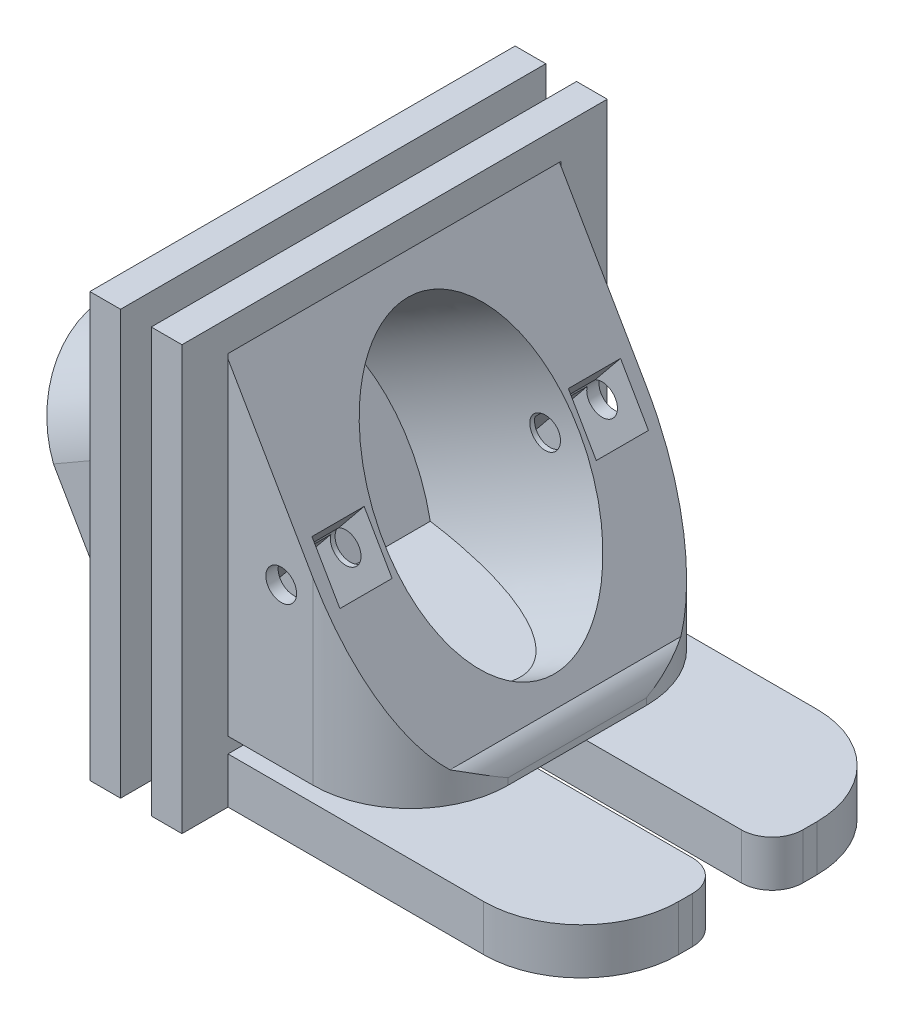
from build123d import *

# Parameters (mm, degrees)
SKETCH2_W           = 21.7
SKETCH2_H           = 25.05
SKETCH2_RX          = 9.525
SKETCH2_RY          = 6.35
BOSS_EXTRUDE1_DEPTH = 12.7
SKETCH3_W           = 21.660653916
SKETCH3_H           = 25.05
BOSS_EXTRUDE2_DEPTH = 3
SKETCH5_W           = 18.892037138
SKETCH5_H           = 21.7
BOSS_EXTRUDE3_DEPTH = 2
SKETCH6_W           = 30
SKETCH6_H           = 21.7
BOSS_EXTRUDE4_DEPTH = 4
SKETCH7_W           = 21.7
SKETCH7_H           = 1
SKETCH7_W_2         = 3.175
SKETCH7_H_2         = 3
CUT_EXTRUDE2_DEPTH  = 23
SKETCH7_3_W         = 21.7
SKETCH7_3_H         = 7.272473706
CUT_EXTRUDE3_DEPTH  = 44.803879418
SKETCH11_R          = 1
CUT_EXTRUDE8_DEPTH  = 33.487034031
CUT_EXTRUDE4_REACH  = 47.088
SKETCH9_R           = 1
SKETCH15_W          = 3.4
SKETCH15_H          = 3.4
CUT_EXTRUDE9_DEPTH  = 28.443249332
BOSS_EXTRUDE5_DEPTH = 2
BOSS_EXTRUDE6_DEPTH = 2
FILLET5_R           = 6.35
FILLET6_R           = 2
FILLET7_R           = 2
SKETCH19_W          = 2
SKETCH19_H          = 4
CUT_EXTRUDE10_DEPTH = 48.148292291


with BuildPart() as part:
    # Sketch2 → Boss-Extrude1 (new body)
    with BuildSketch(Plane(origin=(16.497783942, 9.525, 0), x_dir=(0, 0, -1), z_dir=(0.8660254037844379, 0.5000000000000013, 0))):
        Rectangle(SKETCH2_W, SKETCH2_H)
        with Locations(Location((0, 0), (0, 0, 90))):
            Ellipse(SKETCH2_RX, SKETCH2_RY, mode=Mode.SUBTRACT)
    extrude(amount=-BOSS_EXTRUDE1_DEPTH)

    # Sketch3 → Boss-Extrude2 (add)
    with BuildSketch(Plane(origin=(5.499261314, 3.175, 0), x_dir=(0, 0, 1), z_dir=(-0.8660254037844379, -0.5000000000000014, 0))):
        with Locations((-0.019673042, 0)):
            Rectangle(SKETCH3_W, SKETCH3_H)
    extrude(amount=BOSS_EXTRUDE2_DEPTH)

    # Sketch5 → Boss-Extrude3 (add)
    with BuildSketch(Plane(origin=(0, 0, 0), x_dir=(-1, 0, 0), z_dir=(0, 1, 0))):
        with Locations((-13.314265373, 0)):
            Rectangle(SKETCH5_W, SKETCH5_H)
    extrude(amount=-BOSS_EXTRUDE3_DEPTH)

    # Sketch6 → Boss-Extrude4 (add)
    with BuildSketch(Plane.XZ.offset(2)):
        with Locations((18.868246804, 0)):
            Rectangle(SKETCH6_W, SKETCH6_H)
    extrude(amount=BOSS_EXTRUDE4_DEPTH)

    # Sketch7 → Cut-Extrude2 (cut)
    with BuildSketch(Plane(origin=(33.868246804, 0, 0), x_dir=(0, 0, -1), z_dir=(1, 0, 0))):
        with Locations((0, -2.5)):
            Rectangle(SKETCH7_W, SKETCH7_H)
        with Locations((0, -4.5)):
            Rectangle(SKETCH7_W_2, SKETCH7_H_2)
    extrude(amount=-CUT_EXTRUDE2_DEPTH, mode=Mode.SUBTRACT)

    # Sketch7<3> → Cut-Extrude3 (cut, through all)
    with BuildSketch(Plane(origin=(33.868246804, 0, 0), x_dir=(0, 0, -1), z_dir=(1, 0, 0))):
        with Locations((0, -9.636236853)):
            Rectangle(SKETCH7_3_W, SKETCH7_3_H)
    extrude(amount=-CUT_EXTRUDE3_DEPTH, mode=Mode.SUBTRACT)

    # Sketch11 → Cut-Extrude8 (cut, through all)
    with BuildSketch(Plane(origin=(19.672783942, 0.194872981, 0), x_dir=(0, 0, -1), z_dir=(-1, 0, 0))):
        with Locations(Location((0, -3.830865705, 0), (0, 0, 90))):
            Circle(SKETCH11_R)
    extrude(amount=CUT_EXTRUDE8_DEPTH, mode=Mode.SUBTRACT)

    # Sketch9 → Cut-Extrude4 (cut, up to next)
    with BuildSketch(Plane(origin=(0, 0, -10.85), x_dir=(-1, 0, 0), z_dir=(0, 0, -1)), mode=Mode.PRIVATE) as cut_extrude4_sk1:
        with Locations((-14.332720433, 8.275)):
            Circle(SKETCH9_R)
    cut_extrude4_tool1 = extrude(cut_extrude4_sk1.sketch, amount=-CUT_EXTRUDE4_REACH, mode=Mode.PRIVATE) & part.part
    cut_extrude4 = cut_extrude4_tool1.solids().sort_by_distance((14.33272, 8.275, -10.85))[0]
    add(cut_extrude4, mode=Mode.SUBTRACT)

    # Sketch15 → Cut-Extrude9 (cut, symmetric)
    with BuildSketch(Plane(origin=(16.497783942, 9.525, 0), x_dir=(0.7757354378747654, -0.6310582623064579, 0), z_dir=(0.6310582623064579, 0.7757354378747654, 0))):
        with Locations((-0.1, -8.35)):
            Rectangle(SKETCH15_W, SKETCH15_H)
    cut_extrude9 = extrude(amount=CUT_EXTRUDE9_DEPTH, both=True, mode=Mode.SUBTRACT)

    # Sketch16 → Boss-Extrude5 (add)
    with BuildSketch(Plane(origin=(8.868246804, 0, 0), x_dir=(0, 0, -1), z_dir=(1, 0, 0))):
        Polygon((-10.85, -6), (-10.85, 19.582708922), (0, 19.582708922), (0, 21.582708922), (-13.85, 21.582708922), (-13.85, -6), align=None)
    boss_extrude5 = extrude(amount=BOSS_EXTRUDE5_DEPTH)

    # Sketch18 → Boss-Extrude6 (add)
    with BuildSketch(Plane.ZY.offset(-6.868246804)):
        Polygon((10.85, -6), (13.85, -6), (13.85, 21.582708922), (0, 21.582708922), (0, 14.582708922), (10.85, 14.582708922), align=None)
    boss_extrude6 = extrude(amount=BOSS_EXTRUDE6_DEPTH)

    # Mirror1: Cut-Extrude4, Cut-Extrude9, Boss-Extrude5, Boss-Extrude6 across plane
    add(cut_extrude4.mirror(Plane.XY), mode=Mode.SUBTRACT)
    add(cut_extrude9.mirror(Plane.XY), mode=Mode.SUBTRACT)
    add(boss_extrude5.mirror(Plane.XY))
    add(boss_extrude6.mirror(Plane.XY))

    # Fillet5
    fillet5_edges = [part.edges().sort_by_distance(p)[0] for p in [
        (22.760283942, -1, 10.85),
        (22.760283942, -1, -10.85),
        (0.753465953, 14.897638014, -10.85),
        (2.052504059, 15.647638014, 10.85),
        (33.868246804, -4.5, -10.85),
        (33.868246804, -4.5, 10.85),
    ]]
    fillet(fillet5_edges, radius=FILLET5_R)

    # Fillet6
    fillet6_edges = [part.edges().sort_by_distance(p)[0] for p in [
        (33.868246804, -4.5, 1.5875),
        (33.868246804, -4.5, -1.5875),
    ]]
    fillet(fillet6_edges, radius=FILLET6_R)

    # Fillet7
    # the kernel refuses this fillet: 2 mm, written as the material it takes off along each edge
    with BuildSketch(Plane(origin=(22.760283942, 0, 8.429393602), x_dir=(0, -1, 0), z_dir=(0, 0, -1))) as fillet7_piece_1:
        with BuildLine():
            CenterArc((1.571757441, 2), FILLET7_R, 218.197977663, 51.802022337)
            Line((0, 0.763238686), (-0.031435149, 0.73850346))
            ThreePointArc((-0.031435149, 0.73850346), (-0.04, 0.381619343), (-0.04, 0))
            Line((-0.04, 0), (0, -0.04))
            Line((0, -0.04), (1.571757441, -0.04))
            Line((1.571757441, -0.04), (1.571757441, 0))
        make_face()
    extrude(amount=16.858787203, mode=Mode.SUBTRACT)

    # Sketch19 → Cut-Extrude10 (cut, through all)
    with BuildSketch(Plane.XY.offset(10.85)):
        with Locations((7.868246804, 19.582708922)):
            Rectangle(SKETCH19_W, SKETCH19_H)
    extrude(amount=-CUT_EXTRUDE10_DEPTH, mode=Mode.SUBTRACT)


solid = part.part
